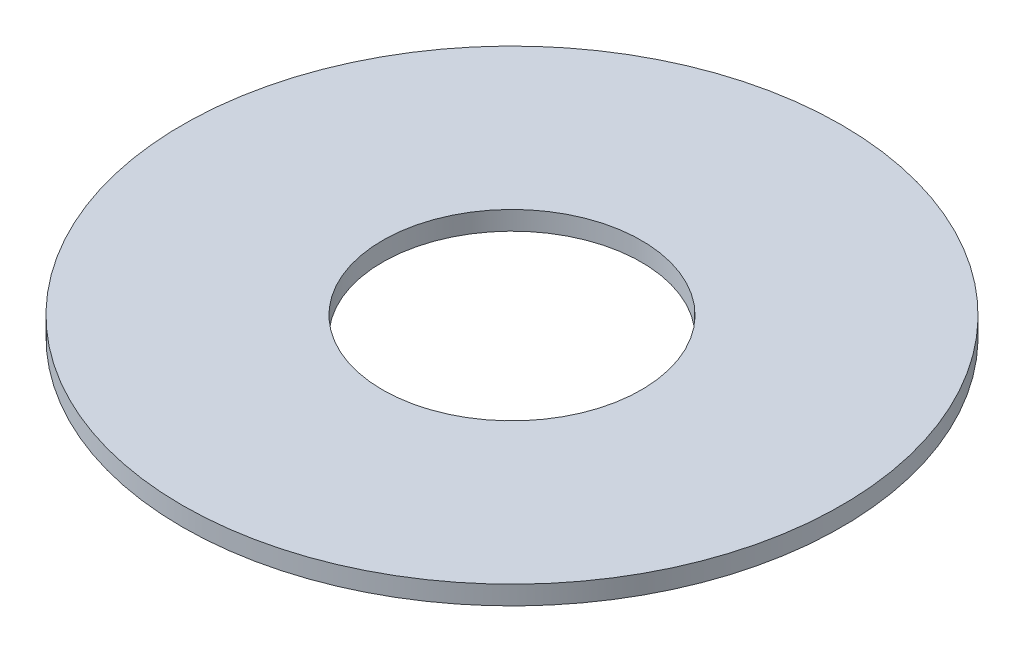
from build123d import *

# Parameters (mm, degrees)
SKETCH1_R           = 70
BOSS_EXTRUDE1_DEPTH = 4
SKETCH2_R           = 27.5
CUT_EXTRUDE1_DEPTH  = 100.075728612


with BuildPart() as part:
    # Sketch1 → Boss-Extrude1 (new body)
    with BuildSketch(Plane(origin=(0, 0, 0), x_dir=(1, 0, 0), z_dir=(0, 1, 0))):
        Circle(SKETCH1_R)
    extrude(amount=BOSS_EXTRUDE1_DEPTH)

    # Sketch2 → Cut-Extrude1 (cut, through all)
    with BuildSketch(Plane(origin=(0, 0, 0), x_dir=(1, 0, 0), z_dir=(0, 1, 0))):
        Circle(SKETCH2_R)
    extrude(amount=CUT_EXTRUDE1_DEPTH, mode=Mode.SUBTRACT)


solid = part.part
